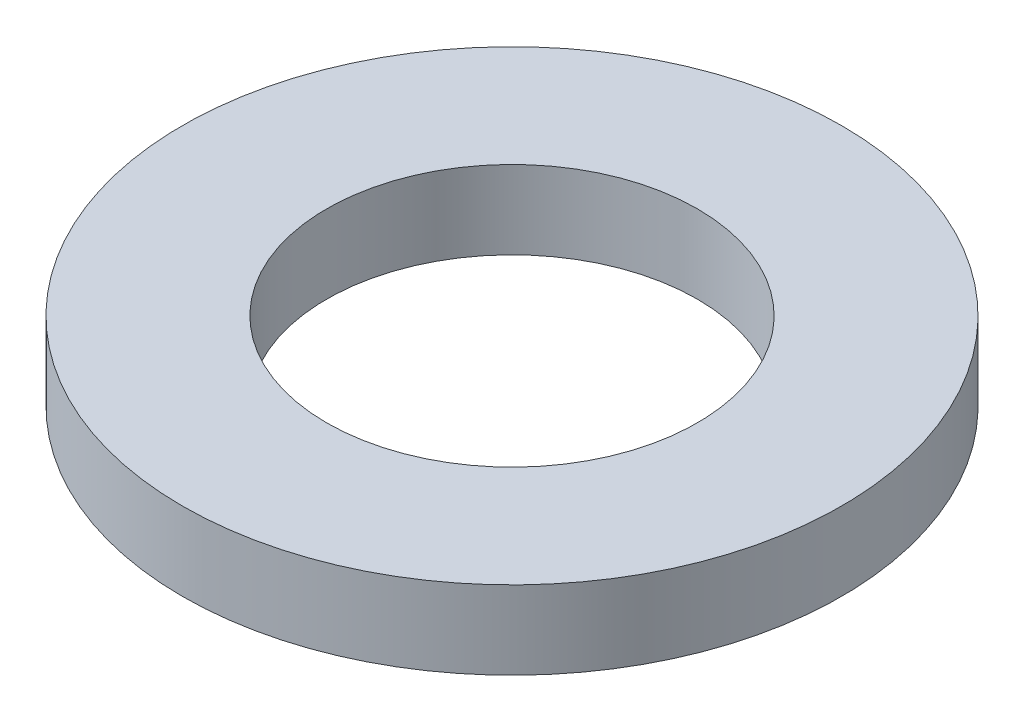
from build123d import *

# Parameters (mm, degrees)
SKETCH1_R           = 80
BOSS_EXTRUDE1_DEPTH = 19
SKETCH2_R           = 45
CUT_EXTRUDE1_DEPTH  = 115.721401665


with BuildPart() as part:
    # Sketch1 → Boss-Extrude1 (new body)
    with BuildSketch(Plane(origin=(0, 0, 0), x_dir=(1, 0, 0), z_dir=(0, 1, 0))):
        Circle(SKETCH1_R)
    extrude(amount=BOSS_EXTRUDE1_DEPTH)

    # Sketch2 → Cut-Extrude1 (cut, through all)
    with BuildSketch(Plane(origin=(0, 0, 0), x_dir=(1, 0, 0), z_dir=(0, 1, 0))):
        Circle(SKETCH2_R)
    extrude(amount=CUT_EXTRUDE1_DEPTH, mode=Mode.SUBTRACT)


solid = part.part
